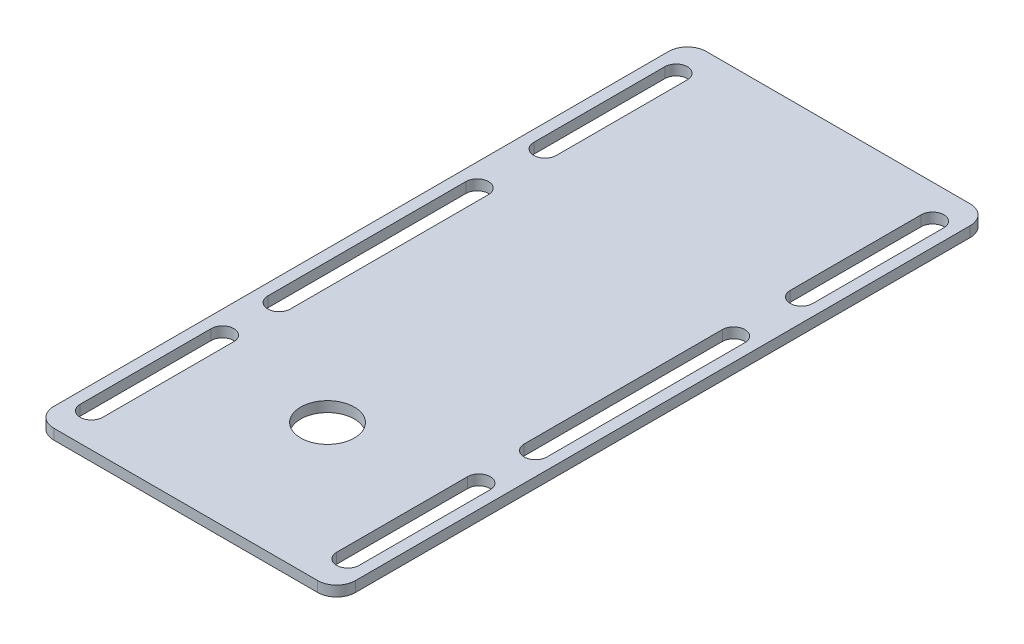
from build123d import *

# Parameters (mm, degrees)
SKETCH1_R           = 7.112045721
BOSS_EXTRUDE1_DEPTH = 2.75


with BuildPart() as part:
    # Sketch1 → Boss-Extrude1 (new body)
    with BuildSketch(Plane(origin=(0, 0, 0), x_dir=(1, 0, 0), z_dir=(0, 1, 0))):
        with BuildLine():
            Line((-35, 86.51875), (35, 86.51875))
            ThreePointArc((35, 86.51875), (38.535533906, 85.054283906), (40, 81.51875))
            Line((40, 81.51875), (40, -81.51875))
            ThreePointArc((40, -81.51875), (38.535533906, -85.054283906), (35, -86.51875))
            Line((35, -86.51875), (-35, -86.51875))
            ThreePointArc((-35, -86.51875), (-38.535533906, -85.054283906), (-40, -81.51875))
            Line((-40, -81.51875), (-40, 81.51875))
            ThreePointArc((-40, 81.51875), (-38.535533906, 85.054283906), (-35, 86.51875))
        make_face()
        with Locations((0, -48.920084539)):
            Circle(SKETCH1_R, mode=Mode.SUBTRACT)
        with BuildLine():
            Line((37, 77.51875), (37, 42.76875))
            ThreePointArc((37, 42.76875), (34, 39.76875), (31, 42.76875))
            Line((31, 42.76875), (31, 77.51875))
            ThreePointArc((31, 77.51875), (34, 80.51875), (37, 77.51875))
        make_face(mode=Mode.SUBTRACT)
        with BuildLine():
            Line((-37, 77.51875), (-37, 42.76875))
            ThreePointArc((-37, 42.76875), (-34, 39.76875), (-31, 42.76875))
            Line((-31, 42.76875), (-31, 77.51875))
            ThreePointArc((-31, 77.51875), (-34, 80.51875), (-37, 77.51875))
        make_face(mode=Mode.SUBTRACT)
        with BuildLine():
            Line((37, -77.51875), (37, -42.76875))
            ThreePointArc((37, -42.76875), (34, -39.76875), (31, -42.76875))
            Line((31, -42.76875), (31, -77.51875))
            ThreePointArc((31, -77.51875), (34, -80.51875), (37, -77.51875))
        make_face(mode=Mode.SUBTRACT)
        with BuildLine():
            Line((-37, -77.51875), (-37, -42.76875))
            ThreePointArc((-37, -42.76875), (-34, -39.76875), (-31, -42.76875))
            Line((-31, -42.76875), (-31, -77.51875))
            ThreePointArc((-31, -77.51875), (-34, -80.51875), (-37, -77.51875))
        make_face(mode=Mode.SUBTRACT)
        with BuildLine():
            Line((37, 24.76875), (37, -27.76875))
            ThreePointArc((37, -27.76875), (34, -30.76875), (31, -27.76875))
            Line((31, -27.76875), (31, 24.76875))
            ThreePointArc((31, 24.76875), (34, 27.76875), (37, 24.76875))
        make_face(mode=Mode.SUBTRACT)
        with BuildLine():
            Line((-37, 24.76875), (-37, -27.76875))
            ThreePointArc((-37, -27.76875), (-34, -30.76875), (-31, -27.76875))
            Line((-31, -27.76875), (-31, 24.76875))
            ThreePointArc((-31, 24.76875), (-34, 27.76875), (-37, 24.76875))
        make_face(mode=Mode.SUBTRACT)
    extrude(amount=BOSS_EXTRUDE1_DEPTH)


solid = part.part
